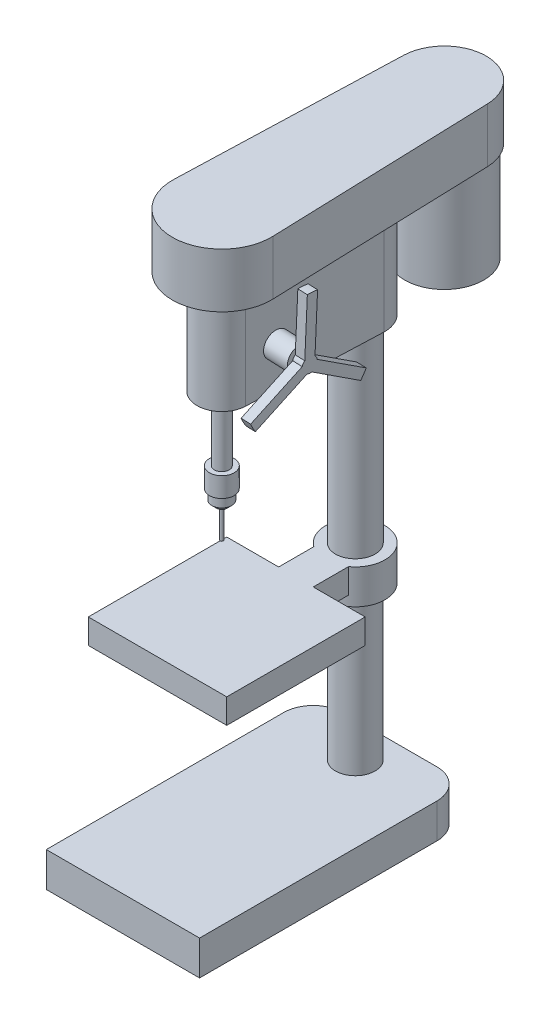
from build123d import *
from build123d.topology import SkipClean

# Parameters (mm, degrees)
SKETCH_1_W          = 310
SKETCH_1_H          = 540
EXTRUDE_1_DEPTH     = 70
FILLET_1_R          = 60
SKETCH_2_R          = 40
EXTRUDE_2_DEPTH     = 310
SKETCH_3_R          = 60
EXTRUDE_3_DEPTH     = 20
EXTRUDE_4_DEPTH     = 50
SKETCH_5_R          = 40
EXTRUDE_5_DEPTH     = 400
EXTRUDE_6_DEPTH     = 210
EXTRUDE_7_DEPTH     = 110
SKETCH_10_R         = 80
EXTRUDE_8_DEPTH     = 200
SKETCH_11_R         = 15
EXTRUDE_9_DEPTH     = 130
SKETCH_12_R         = 25
EXTRUDE_10_DEPTH    = 40
SKETCH_13_R         = 20
EXTRUDE_11_DEPTH    = 30
CHAMFER_1_SIZE      = 10
SKETCH_14_R         = 3.5
EXTRUDE_12_DEPTH    = 60
SKETCH_15_R         = 25
EXTRUDE_13_DEPTH    = 50
SKETCH_16_R         = 125
EXTRUDE_14_DEPTH    = 20
CUT_EXTRUDE_START   = -20
CUT_EXTRUDE_1_DEPTH = 20
SCALE_1_SCALE       = 0.8


with BuildPart() as part:
    # ｽｹｯﾁ1 → ﾎﾞｽ - 押し出し1 (new body)
    with BuildSketch(Plane(origin=(0, 0, 0), x_dir=(1, 0, 0), z_dir=(0, 1, 0))):
        with Locations((155, 270)):
            Rectangle(SKETCH_1_W, SKETCH_1_H)
    extrude(amount=EXTRUDE_1_DEPTH)

    # ﾌｨﾚｯﾄ1
    fillet_1_edges = [part.edges().sort_by_distance(p)[0] for p in [
        (0, 35, -540),
        (310, 35, -540),
    ]]
    fillet(fillet_1_edges, radius=FILLET_1_R)

    # ｽｹｯﾁ2 → ﾎﾞｽ - 押し出し2 (add)
    with BuildSketch(Plane(origin=(0, 70, 0), x_dir=(1, 0, 0), z_dir=(0, 1, 0))):
        with Locations((155, 470)):
            Circle(SKETCH_2_R)
    extrude(amount=EXTRUDE_2_DEPTH)

    # ｽｹｯﾁ3 → ﾎﾞｽ - 押し出し3 (add)
    with BuildSketch(Plane(origin=(0, 380, 0), x_dir=(1, 0, 0), z_dir=(0, 1, 0))):
        with Locations((155, 470)):
            Circle(SKETCH_3_R)
    extrude(amount=EXTRUDE_3_DEPTH)

    # ｽｹｯﾁ4 → ﾎﾞｽ - 押し出し4 (add)
    with SkipClean():  # the faces are left unmerged after this step: merging them gives an invalid solid
        with BuildSketch(Plane(origin=(0, 400, 0), x_dir=(1, 0, 0), z_dir=(0, 1, 0))):
            with BuildLine():
                Line((190, 350), (295, 350))
                Line((295, 350), (295, 70))
                Line((295, 70), (15, 70))
                Line((15, 70), (15, 350))
                Line((15, 350), (120, 350))
                Line((120, 350), (120, 421.266028))
                ThreePointArc((120, 421.266028), (155, 530), (190, 421.266028))
                Line((190, 421.266028), (190, 350))
            make_face()
        extrude(amount=EXTRUDE_4_DEPTH)

    # ｽｹｯﾁ5 → ﾎﾞｽ - 押し出し5 (add)
    with SkipClean():  # the faces are left unmerged after this step: merging them gives an invalid solid
        with BuildSketch(Plane(origin=(0, 450, 0), x_dir=(1, 0, 0), z_dir=(0, 1, 0))):
            with Locations((155, 470)):
                Circle(SKETCH_5_R)
        extrude(amount=EXTRUDE_5_DEPTH)

    # ｽｹｯﾁ8 → ﾎﾞｽ - 押し出し6 (add)
    with SkipClean():  # the faces are left unmerged after this step: merging them gives an invalid solid
        with BuildSketch(Plane(origin=(0, 850, 0), x_dir=(1, 0, 0), z_dir=(0, 1, 0))):
            with BuildLine():
                Line((95.041166, 467.777778), (105.034305, 198.148148))
                ThreePointArc((105.034305, 198.148148), (155, 150), (204.965695, 198.148148))
                Line((204.965695, 198.148148), (214.958834, 467.777778))
                ThreePointArc((214.958834, 467.777778), (155, 530), (95.041166, 467.777778))
            make_face()
        extrude(amount=EXTRUDE_6_DEPTH)

    # ｽｹｯﾁ9 → ﾎﾞｽ - 押し出し7 (add)
    with SkipClean():  # the faces are left unmerged after this step: merging them gives an invalid solid
        with BuildSketch(Plane(origin=(0, 1060, 0), x_dir=(1, 0, 0), z_dir=(0, 1, 0))):
            with BuildLine():
                Line((55.055571, 203.333333), (70.047235, 652.833333))
                ThreePointArc((70.047235, 652.833333), (155, 735), (239.952765, 652.833333))
                Line((239.952765, 652.833333), (254.944429, 203.333333))
                ThreePointArc((254.944429, 203.333333), (155, 100), (55.055571, 203.333333))
            make_face()
        extrude(amount=EXTRUDE_7_DEPTH)

    # ｽｹｯﾁ10 → ﾎﾞｽ - 押し出し8 (add)
    with SkipClean():  # the faces are left unmerged after this step: merging them gives an invalid solid
        with BuildSketch(Plane(origin=(0, 1060, 0), x_dir=(-1, 0, 0), z_dir=(0, -1, 0))):
            with Locations((-155, 650)):
                Circle(SKETCH_10_R)
        extrude(amount=EXTRUDE_8_DEPTH)

    # ｽｹｯﾁ11 → ﾎﾞｽ - 押し出し9 (add)
    with SkipClean():  # the faces are left unmerged after this step: merging them gives an invalid solid
        with BuildSketch(Plane(origin=(0, 850, 0), x_dir=(-1, 0, 0), z_dir=(0, -1, 0))):
            with Locations((-155, 200)):
                Circle(SKETCH_11_R)
        extrude(amount=EXTRUDE_9_DEPTH)

    # ｽｹｯﾁ12 → ﾎﾞｽ - 押し出し10 (add)
    with SkipClean():  # the faces are left unmerged after this step: merging them gives an invalid solid
        with BuildSketch(Plane(origin=(0, 720, 0), x_dir=(-1, 0, 0), z_dir=(0, -1, 0))):
            with Locations((-155, 200)):
                Circle(SKETCH_12_R)
        extrude(amount=EXTRUDE_10_DEPTH)

    # ｽｹｯﾁ13 → ﾎﾞｽ - 押し出し11 (add)
    with SkipClean():  # the faces are left unmerged after this step: merging them gives an invalid solid
        with BuildSketch(Plane(origin=(0, 680, 0), x_dir=(-1, 0, 0), z_dir=(0, -1, 0))):
            with Locations((-155, 200)):
                Circle(SKETCH_13_R)
        extrude(amount=EXTRUDE_11_DEPTH)

    # 面取り1
    chamfer_1_edges = [part.edges().sort_by_distance(p)[0] for p in [
        (175, 650, -200),
    ]]
    chamfer(chamfer_1_edges, length=CHAMFER_1_SIZE)

    # ｽｹｯﾁ14 → ﾎﾞｽ - 押し出し12 (add)
    with SkipClean():  # the faces are left unmerged after this step: merging them gives an invalid solid
        with BuildSketch(Plane(origin=(0, 650, 0), x_dir=(-1, 0, 0), z_dir=(0, -1, 0))):
            with Locations((-155, 200)):
                Circle(SKETCH_14_R)
        extrude(amount=EXTRUDE_12_DEPTH)

    # ｽｹｯﾁ15 → ﾎﾞｽ - 押し出し13 (add)
    with SkipClean():  # the faces are left unmerged after this step: merging them gives an invalid solid
        with BuildSketch(Plane(origin=(197.35075, 0, 7.314305), x_dir=(0.0370370370370371, 0, -0.9993138935727439), z_dir=(0.9993138935727439, 0, 0.0370370370370371))):
            with Locations((265.603519, 930)):
                Circle(SKETCH_15_R)
        extrude(amount=EXTRUDE_13_DEPTH)

    # ｽｹｯﾁ16 → ﾎﾞｽ - 押し出し14 (add)
    with SkipClean():  # the faces are left unmerged after this step: merging them gives an invalid solid
        with BuildSketch(Plane(origin=(247.316444, 0, 9.166157), x_dir=(0.03703703703703711, 0, -0.9993138935727439), z_dir=(0.9993138935727439, 0, 0.03703703703703711))):
            with Locations((265.603519, 930)):
                Circle(SKETCH_16_R)
        extrude(amount=EXTRUDE_14_DEPTH)

    # ｽｹｯﾁ17 → ｶｯﾄ - 押し出し1 (cut)
    with SkipClean():  # the faces are left unmerged after this step: merging them gives an invalid solid
        with BuildSketch(Plane(origin=(267.302722, 0, 9.906898), x_dir=(0.037037037037037125, 0, -0.9993138935727439), z_dir=(0.9993138935727439, 0, 0.037037037037037125)).offset(CUT_EXTRUDE_START)):
            with BuildLine():
                Line((150.427943, 881.424424), (251.071785, 933.718695))
                ThreePointArc((251.071785, 933.718695), (252.958803, 938.069148), (256.109578, 941.613142))
                Line((256.109578, 941.613142), (261.143332, 1054.920402))
                ThreePointArc((261.143332, 1054.920402), (160.230883, 997.242899), (150.427943, 881.424424))
            make_face()
            with BuildLine():
                Line((260.293214, 915.971434), (159.649372, 863.677163))
                ThreePointArc((159.649372, 863.677163), (260.055779, 805.12317), (365.258991, 854.542813))
                Line((365.258991, 854.542813), (269.648903, 915.555801))
                ThreePointArc((269.648903, 915.555801), (264.937791, 915.01478), (260.293214, 915.971434))
            make_face()
            with BuildLine():
                ThreePointArc((376.017854, 871.402435), (376.523896, 987.633931), (281.123625, 1054.032763))
                Line((281.123625, 1054.032763), (276.089871, 940.725504))
                ThreePointArc((276.089871, 940.725504), (278.913965, 936.916072), (280.407766, 932.415423))
                Line((280.407766, 932.415423), (376.017854, 871.402435))
            make_face()
        extrude(amount=CUT_EXTRUDE_1_DEPTH, mode=Mode.SUBTRACT)


with BuildPart() as part_1:
    # ｽｹｰﾙ1: scaled about (155.536017, 662.753174, -369.111792)
    add(part.part.scale(SCALE_1_SCALE).moved(Location((31.107203, 132.550635, -73.822358))))


solid = part_1.part
